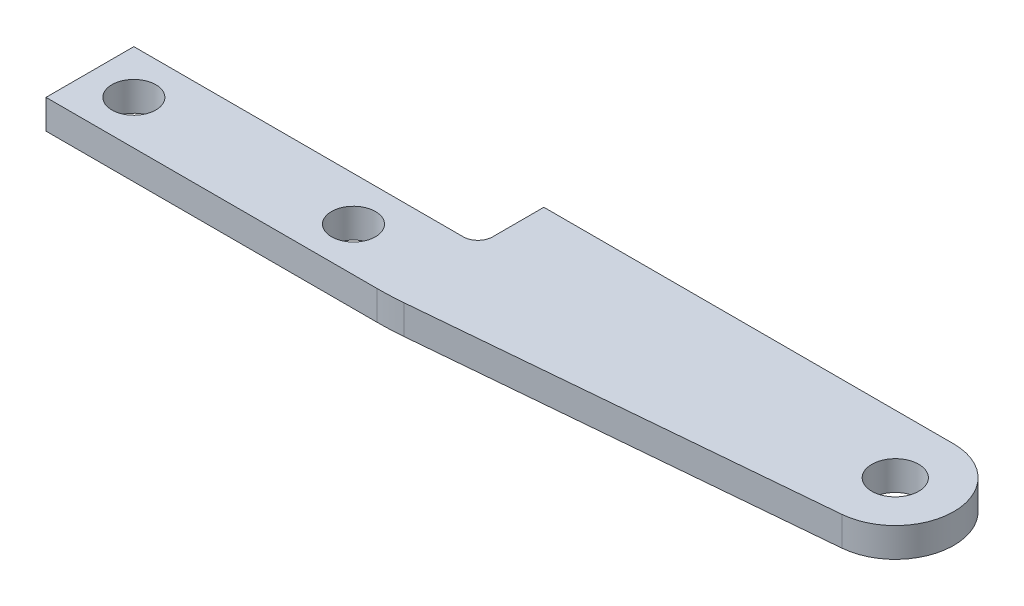
from build123d import *

# Parameters (mm, degrees)
SKETCH_2_R      = 1.5
SKETCH_2_R_2    = 1.6
EXTRUDE_2_DEPTH = 2
FILLET_1_R      = 1
FILLET_2_R      = 20


with BuildPart() as part:
    # 草图2 → 凸台-拉伸2 (new body)
    with BuildSketch(Plane(origin=(0, 0, 0), x_dir=(1, 0, 0), z_dir=(0, 1, 0))):
        with BuildLine():
            Line((20.5, 3), (-3, 3))
            Line((-3, 3), (-3, -3))
            Line((-3, -3), (20.5, -3))
            Line((20.5, -3), (48.853509418, -0.484348264))
            ThreePointArc((48.853509418, -0.484348264), (52.49608515, 3.676927871), (48.5, 7.5))
            Line((48.5, 7.5), (20.5, 7.5))
            Line((20.5, 7.5), (20.5, 3))
        make_face()
        with Locations(Location((0, 0, 0), (0, 0, 90))):
            Circle(SKETCH_2_R, mode=Mode.SUBTRACT)
        with Locations(Location((15, 0, 0), (0, 0, 90))):
            Circle(SKETCH_2_R, mode=Mode.SUBTRACT)
        with Locations(Location((48.5, 3.5, 0), (0, 0, 270))):
            Circle(SKETCH_2_R_2, mode=Mode.SUBTRACT)
    extrude(amount=EXTRUDE_2_DEPTH)

    # 圆角1
    fillet_1_edges = [part.edges().sort_by_distance(p)[0] for p in [
        (20.5, 1, -3),
    ]]
    fillet(fillet_1_edges, radius=FILLET_1_R)

    # 圆角2
    # the kernel refuses this fillet: 20 mm, written as the material it takes off along each edge
    with BuildSketch(Plane(origin=(20.5, -2.213765024, 3), x_dir=(0.9960870660689326, 0, -0.08837735462314833), z_dir=(0, 1, 0))) as fillet_2_piece_1:
        with BuildLine():
            CenterArc((FILLET_2_R * 0.0442753004743, FILLET_2_R), FILLET_2_R, 264.929735646, 5.070264354)
            Line((-FILLET_2_R * 0.0441020541488, FILLET_2_R * 0.00391293393107), (0, 0))
            Line((0, 0), (FILLET_2_R * 0.0442753004743, 0))
        make_face()
    extrude(amount=6.427530047, mode=Mode.SUBTRACT)


solid = part.part
